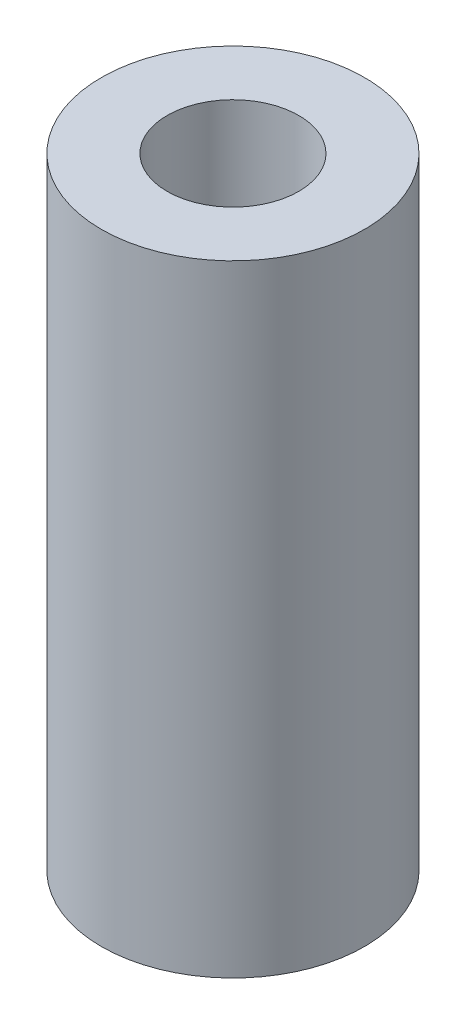
from build123d import *

# Parameters (mm, degrees)
SKETCH1_R           = 15
BOSS_EXTRUDE1_DEPTH = 70.810011851
SKETCH2_R           = 7.503444106
CUT_EXTRUDE1_DEPTH  = 74.919265272


with BuildPart() as part:
    # Sketch1 → Boss-Extrude1 (new body)
    with BuildSketch(Plane(origin=(0, 0, 0), x_dir=(1, 0, 0), z_dir=(0, 1, 0))):
        Circle(SKETCH1_R)
    extrude(amount=BOSS_EXTRUDE1_DEPTH)

    # Sketch2 → Cut-Extrude1 (cut, through all)
    with BuildSketch(Plane(origin=(0, 0, 0), x_dir=(1, 0, 0), z_dir=(0, 1, 0))):
        Circle(SKETCH2_R)
    extrude(amount=CUT_EXTRUDE1_DEPTH, mode=Mode.SUBTRACT)


solid = part.part
